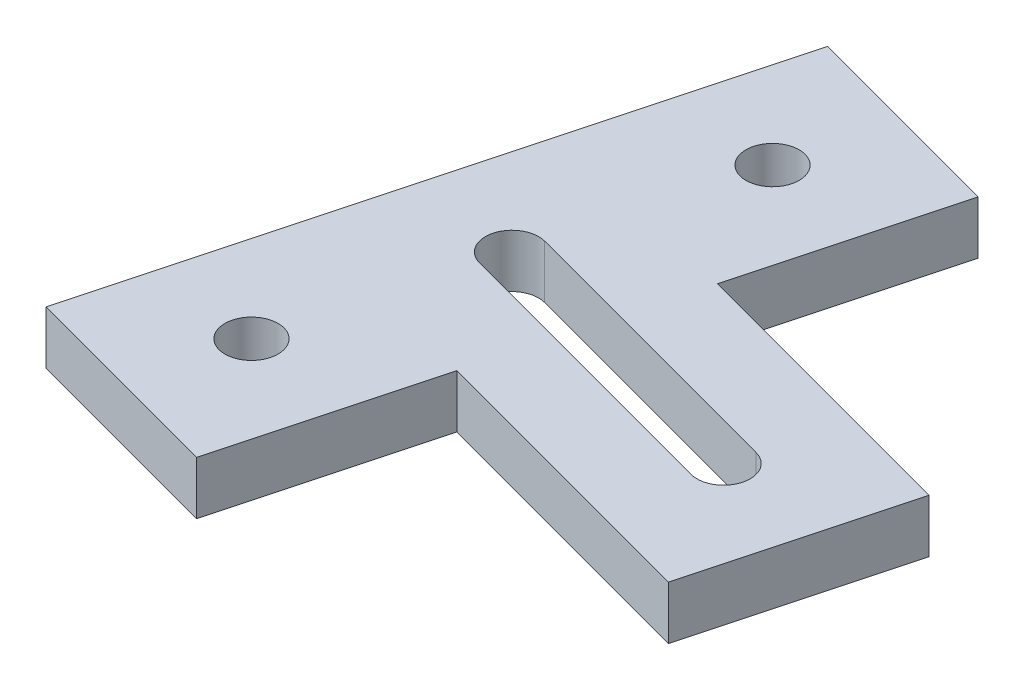
from build123d import *

# Parameters (mm, degrees)
SKETCH1_R           = 3.175
BOSS_EXTRUDE1_DEPTH = 6.35


with BuildPart() as part:
    # Sketch1 → Boss-Extrude1 (new body)
    with BuildSketch(Plane(origin=(0, 0, 0), x_dir=(1, 0, 0), z_dir=(0, 1, 0))):
        Polygon((-32.107267289, -99.867945461), (-25.533263543, -75.333429473), (8.980256121, -84.581299196), (15.554259867, -60.046783208), (-18.959259798, -50.798913486), (-12.385256052, -26.264397498), (-36.91977204, -19.690393752), (-56.641783277, -93.293941716), align=None)
        with BuildLine():
            Line((-33.691769196, -56.712355108), (0.821750468, -65.96022483))
            ThreePointArc((0.821750468, -65.96022483), (3.066814498, -69.848789797), (-0.821750468, -72.093853827))
            Line((-0.821750468, -72.093853827), (-35.335270133, -62.845984105))
            ThreePointArc((-35.335270133, -62.845984105), (-37.580334163, -58.957419139), (-33.691769196, -56.712355108))
        make_face(mode=Mode.SUBTRACT)
        with Locations((-41.08752341, -84.313685595)):
            Circle(SKETCH1_R, mode=Mode.SUBTRACT)
        with Locations((-27.939515919, -35.244653619)):
            Circle(SKETCH1_R, mode=Mode.SUBTRACT)
    extrude(amount=BOSS_EXTRUDE1_DEPTH)


solid = part.part
